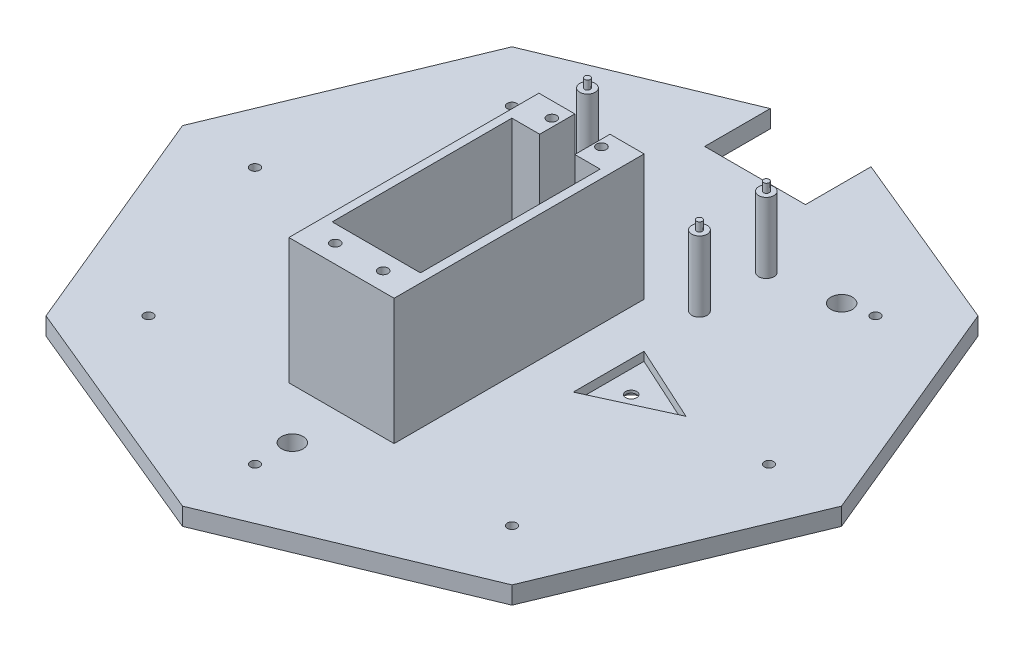
from build123d import *

# Parameters (mm, degrees)
AUFSATZ_LINEAR_AUSTRAGEN1_DEPTH      = 3
AUFSATZ_LINEAR_AUSTRAGEN1_DEPTH_BACK = 1
AUFSATZ_LINEAR_AUSTRAGEN3_DEPTH      = 31.65
SKIZZE7_R                            = 2.45
SCHNITT_LINEAR_AUSTRAGEN2_DEPTH      = 110.867294952
SCHNITT_LINEAR_AUSTRAGEN6_DEPTH      = 2
SKIZZE10_R                           = 1.25
SCHNITT_LINEAR_AUSTRAGEN7_DEPTH      = 111.405717696
SKIZZE11_R                           = 2.75
SCHNITT_LINEAR_AUSTRAGEN8_DEPTH      = 1.4
SKIZZE14_R                           = 1.075
SCHNITT_LINEAR_AUSTRAGEN9_DEPTH      = 10
SKIZZE15_R                           = 1.75
AUFSATZ_LINEAR_AUSTRAGEN4_DEPTH      = 16
SKIZZE16_R                           = 0.65
AUFSATZ_LINEAR_AUSTRAGEN5_DEPTH      = 2
SKIZZE18_R                           = 1.1
SCHNITT_LINEAR_AUSTRAGEN10_DEPTH     = 13
SCHNITT_LINEAR_AUSTRAGEN11_DEPTH     = 10


with BuildPart() as part:
    # Skizze2 → Aufsatz-Linear austragen1 (new, two sides: drawn at the far end of the back side and taken through both)
    with BuildSketch(Plane(origin=(0, 0, 0), x_dir=(1, 0, 0), z_dir=(0, 1, 0)).offset(-AUFSATZ_LINEAR_AUSTRAGEN1_DEPTH_BACK)):
        Polygon((-53.033008589, 53.033008589), (-75, 0), (-53.033008589, -53.033008589), (0, -75), (53.033008589, -53.033008589), (75, 0), (53.033008589, 53.033008589), (0, 75), align=None)
    extrude(amount=AUFSATZ_LINEAR_AUSTRAGEN1_DEPTH + AUFSATZ_LINEAR_AUSTRAGEN1_DEPTH_BACK)

    # Skizze5 → Aufsatz-Linear austragen3 (add)
    with BuildSketch(Plane(origin=(0, 0, 0), x_dir=(1, 0, 0), z_dir=(0, 1, 0))):
        Polygon((-4, 18.306991411), (-4, 10.306991411), (-10.335850601, 10.306991411), (-10.335850601, -30.593008589), (9.764149399, -30.593008589), (9.764149399, 10.306991411), (4, 10.306991411), (4, 18.306991411), (11.764149399, 18.306991411), (11.764149399, -38.593008589), (-12.185850601, -38.593008589), (-12.185850601, 18.306991411), align=None)
    extrude(amount=AUFSATZ_LINEAR_AUSTRAGEN3_DEPTH)

    # Skizze7 → Schnitt-Linear austragen2 (cut, through all)
    with BuildSketch(Plane(origin=(0, 3, 0), x_dir=(1, 0, 0), z_dir=(0, 1, 0))):
        with Locations((35.03291512, 39.999993229)):
            Circle(SKIZZE7_R)
        with Locations((-34.96707477, 39.962371165)):
            Circle(SKIZZE7_R)
        with Locations((0, -50)):
            Circle(SKIZZE7_R)
    extrude(amount=-SCHNITT_LINEAR_AUSTRAGEN2_DEPTH, mode=Mode.SUBTRACT)

    # Skizze8 → Schnitt-Linear austragen6 (cut)
    with BuildSketch(Plane(origin=(0, 3, 0), x_dir=(1, 0, 0), z_dir=(0, 1, 0))):
        Polygon((-22, -8.05), (-22, 8.05), (-39.6, 0), align=None)
        Polygon((39.6, 0), (22, 8.05), (22, -8.05), align=None)
    extrude(amount=-SCHNITT_LINEAR_AUSTRAGEN6_DEPTH, mode=Mode.SUBTRACT)

    # Skizze10 → Schnitt-Linear austragen7 (cut, through all)
    with BuildSketch(Plane(origin=(0, 1, 0), x_dir=(1, 0, 0), z_dir=(0, 1, 0))):
        with Locations((-27.087800905, 0)):
            Circle(SKIZZE10_R)
        with Locations((27.09, 0.05)):
            Circle(SKIZZE10_R)
    extrude(amount=-SCHNITT_LINEAR_AUSTRAGEN7_DEPTH, mode=Mode.SUBTRACT)

    # Skizze11 → Schnitt-Linear austragen8 (cut)
    with BuildSketch(Plane.XZ.offset(1)):
        with Locations((-27.087800905, 0)):
            Circle(SKIZZE11_R)
        with Locations((27.09, -0.05)):
            Circle(SKIZZE11_R)
    extrude(amount=-SCHNITT_LINEAR_AUSTRAGEN8_DEPTH, mode=Mode.SUBTRACT)

    # Skizze14 → Schnitt-Linear austragen9 (cut)
    with BuildSketch(Plane(origin=(0, 3, 0), x_dir=(1, 0, 0), z_dir=(0, 1, 0))):
        with Locations((-58.5, 0)):
            Circle(SKIZZE14_R)
        with Locations((-41.365746699, 41.365746699)):
            Circle(SKIZZE14_R)
        with Locations((41.365746699, 41.365746699)):
            Circle(SKIZZE14_R)
        with Locations((58.5, 0)):
            Circle(SKIZZE14_R)
        with Locations((41.365746699, -41.365746699)):
            Circle(SKIZZE14_R)
        with Locations((-41.365746699, -41.365746699)):
            Circle(SKIZZE14_R)
        with Locations((0, -58.5)):
            Circle(SKIZZE14_R)
    extrude(amount=-SCHNITT_LINEAR_AUSTRAGEN9_DEPTH, mode=Mode.SUBTRACT)

    # Skizze15 → Aufsatz-Linear austragen4 (add)
    with BuildSketch(Plane(origin=(0, 3, 0), x_dir=(1, 0, 0), z_dir=(0, 1, 0))):
        with Locations((-20.36, 22.306991411)):
            Circle(SKIZZE15_R)
        with Locations((20.36, 22.306991411)):
            Circle(SKIZZE15_R)
        with Locations((-20.36, 37.536991411)):
            Circle(SKIZZE15_R)
        with Locations((20.36, 37.536991411)):
            Circle(SKIZZE15_R)
    extrude(amount=AUFSATZ_LINEAR_AUSTRAGEN4_DEPTH)

    # Skizze16 → Aufsatz-Linear austragen5 (add)
    with BuildSketch(Plane(origin=(0, 19, 0), x_dir=(1, 0, 0), z_dir=(0, 1, 0))):
        with Locations((20.36, 22.306991411)):
            Circle(SKIZZE16_R)
        with Locations((20.36, 37.536991411)):
            Circle(SKIZZE16_R)
        with Locations((-20.36, 37.536991411)):
            Circle(SKIZZE16_R)
        with Locations((-20.36, 22.306991411)):
            Circle(SKIZZE16_R)
    extrude(amount=AUFSATZ_LINEAR_AUSTRAGEN5_DEPTH)

    # Skizze18 → Schnitt-Linear austragen10 (cut)
    with BuildSketch(Plane(origin=(0, 31.65, 0), x_dir=(1, 0, 0), z_dir=(0, 1, 0))):
        with Locations((-5.785850601, 14.856991411)):
            Circle(SKIZZE18_R)
        with Locations((5.5, 14.856991411)):
            Circle(SKIZZE18_R)
        with Locations((5.114149399, -34.443008589)):
            Circle(SKIZZE18_R)
        with Locations((-5.785850601, -34.443008589)):
            Circle(SKIZZE18_R)
    extrude(amount=-SCHNITT_LINEAR_AUSTRAGEN10_DEPTH, mode=Mode.SUBTRACT)

    # Skizze19 → Schnitt-Linear austragen11 (cut)
    with BuildSketch(Plane(origin=(0, 3, 0), x_dir=(1, 0, 0), z_dir=(0, 1, 0))):
        Polygon((11.468599725, 55.323785304), (11.468599725, 70.249550452), (0, 75), (-11.468599725, 70.249550452), (-11.468599725, 55.323785304), align=None)
    extrude(amount=-SCHNITT_LINEAR_AUSTRAGEN11_DEPTH, mode=Mode.SUBTRACT)


solid = part.part
